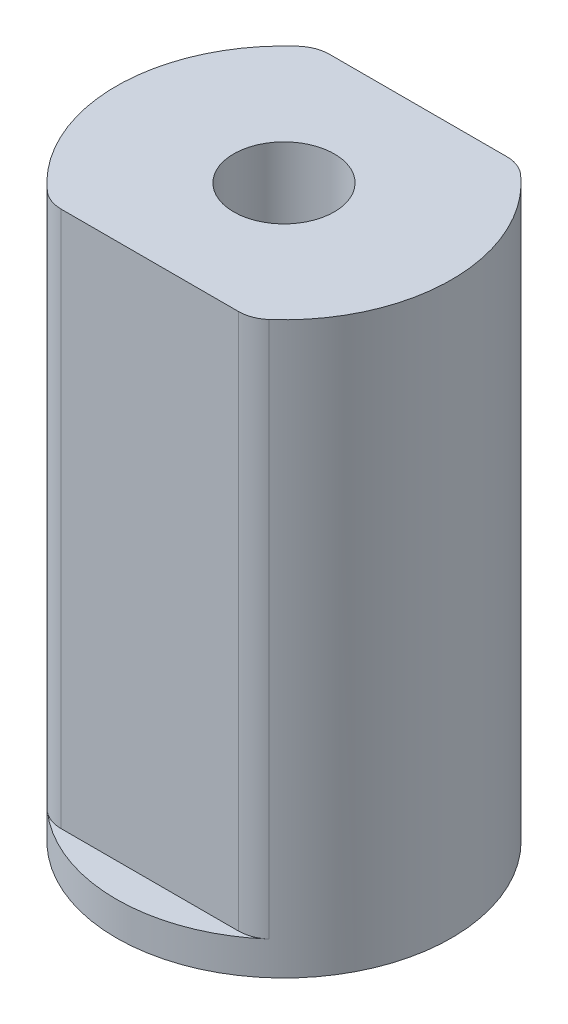
from build123d import *

# Parameters (mm, degrees)
SKETCH2_R           = 2.5
BOSS_EXTRUDE1_DEPTH = 0.5
BOSS_EXTRUDE2_DEPTH = 8
FILLET1_R           = 0.5


with BuildPart() as part:
    # Sketch2 → Boss-Extrude1 (new body)
    with BuildSketch(Plane(origin=(0, 0, 0), x_dir=(1, 0, 0), z_dir=(0, 1, 0))):
        with Locations(Location((0, 0, 0), (0, 0, 270))):
            Circle(SKETCH2_R)
    extrude(amount=BOSS_EXTRUDE1_DEPTH)

    # Sketch3 → Boss-Extrude2 (add)
    with BuildSketch(Plane(origin=(0, 0.5, 0), x_dir=(1, 0, 0), z_dir=(0, 1, 0))):
        with BuildLine():
            Line((1.5, 2), (-1.5, 2))
            ThreePointArc((-1.5, 2), (-2.236067977, 1.118033989), (-2.5, 0))
            Line((-2.5, 0), (-0.75, 0))
            ThreePointArc((-0.75, 0), (0, 0.75), (0.75, 0))
            Line((0.75, 0), (2.5, 0))
            ThreePointArc((2.5, 0), (2.236067977, 1.118033989), (1.5, 2))
        make_face()
        with BuildLine():
            Line((-0.75, 0), (-2.5, 0))
            ThreePointArc((-2.5, 0), (-2.236067977, -1.118033989), (-1.5, -2))
            Line((-1.5, -2), (1.5, -2))
            ThreePointArc((1.5, -2), (2.236067977, -1.118033989), (2.5, 0))
            Line((2.5, 0), (0.75, 0))
            ThreePointArc((0.75, 0), (0, -0.75), (-0.75, 0))
        make_face()
    extrude(amount=BOSS_EXTRUDE2_DEPTH)

    # Fillet1
    # the kernel refuses this fillet: 0.5 mm, written as the material it takes off along each edge
    with BuildSketch(Plane(origin=(-1.5, 0.5, -2), x_dir=(-0.7756085685899518, 0, 0.6312141857799506), z_dir=(0, 1, 0)), Plane(origin=(1.5, 0.5, 2), x_dir=(0.7756085685899534, 0, -0.6312141857799487), z_dir=(0, 1, 0))) as fillet1_piece_1:
        with BuildLine():
            CenterArc((0.178227934, 0.499607683), FILLET1_R, 230.860240122, 41.409622109)
            Line((-0.137379159, 0.111803399), (0, 0))
            ThreePointArc((0, 0), (0.099015519, -0.001961584), (0.198031037, 0))
        make_face()
    extrude(amount=8.495077593, mode=Mode.SUBTRACT)
    with BuildSketch(Plane(origin=(1.5, 0.5, -2), x_dir=(0.7756085685899526, 0, 0.6312141857799497), z_dir=(0, 1, 0)), Plane(origin=(-1.5, 0.5, 2), x_dir=(-0.7756085685899534, 0, -0.6312141857799487), z_dir=(0, 1, 0))) as fillet1_piece_2:
        with BuildLine():
            CenterArc((0.178227934, -0.499607683), FILLET1_R, 87.730137768, 41.409622109)
            Line((-0.137379159, -0.111803399), (0, 0))
            ThreePointArc((0, 0), (0.099015519, 0.001961584), (0.198031037, 0))
        make_face()
    extrude(amount=8.495077593, mode=Mode.SUBTRACT)


solid = part.part
